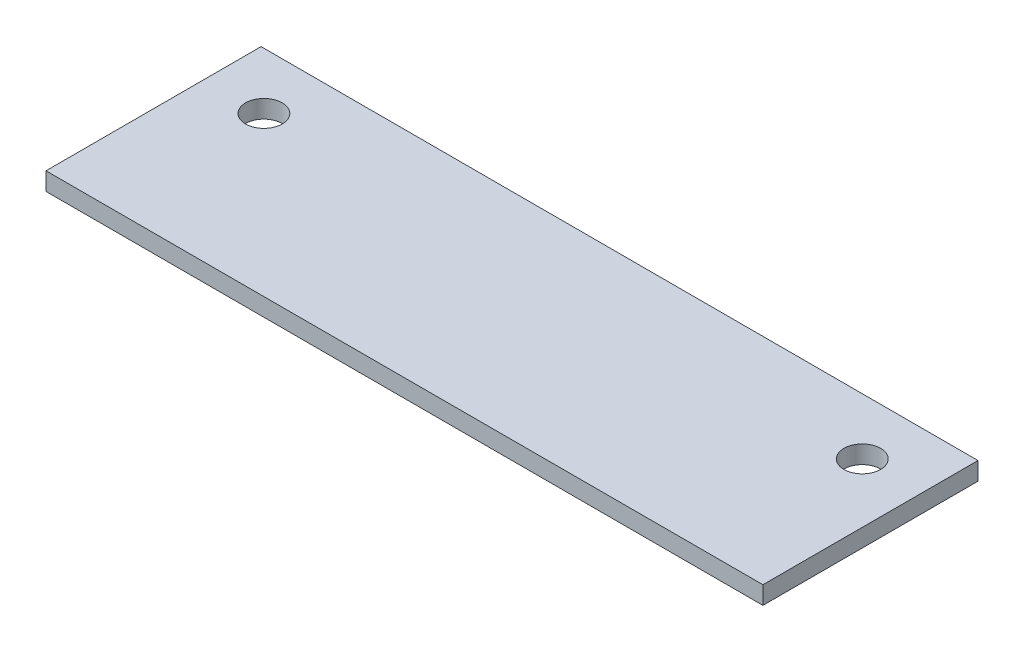
from build123d import *

# Parameters (mm, degrees)
SKETCH1_W           = 127
SKETCH1_H           = 76.2
BOSS_EXTRUDE1_DEPTH = 3.175
SKETCH3_W           = 127
SKETCH3_H           = 38.1
SKETCH3_R           = 3.25
CUT_EXTRUDE1_DEPTH  = 75.121121315


with BuildPart() as part:
    # Sketch1 → Boss-Extrude1 (new body)
    with BuildSketch(Plane(origin=(0, 0, 0), x_dir=(1, 0, 0), z_dir=(0, 1, 0))):
        Rectangle(SKETCH1_W, SKETCH1_H)
    extrude(amount=BOSS_EXTRUDE1_DEPTH)

    # Sketch3 → Cut-Extrude1 (cut, through all)
    with BuildSketch(Plane(origin=(0, 3.175, 0), x_dir=(1, 0, 0), z_dir=(0, 1, 0))):
        with Locations((0, -19.05)):
            Rectangle(SKETCH3_W, SKETCH3_H)
        with Locations((53, 28.1)):
            Circle(SKETCH3_R)
        with Locations((-53, 28.1)):
            Circle(SKETCH3_R)
    extrude(amount=-CUT_EXTRUDE1_DEPTH, mode=Mode.SUBTRACT)


solid = part.part
